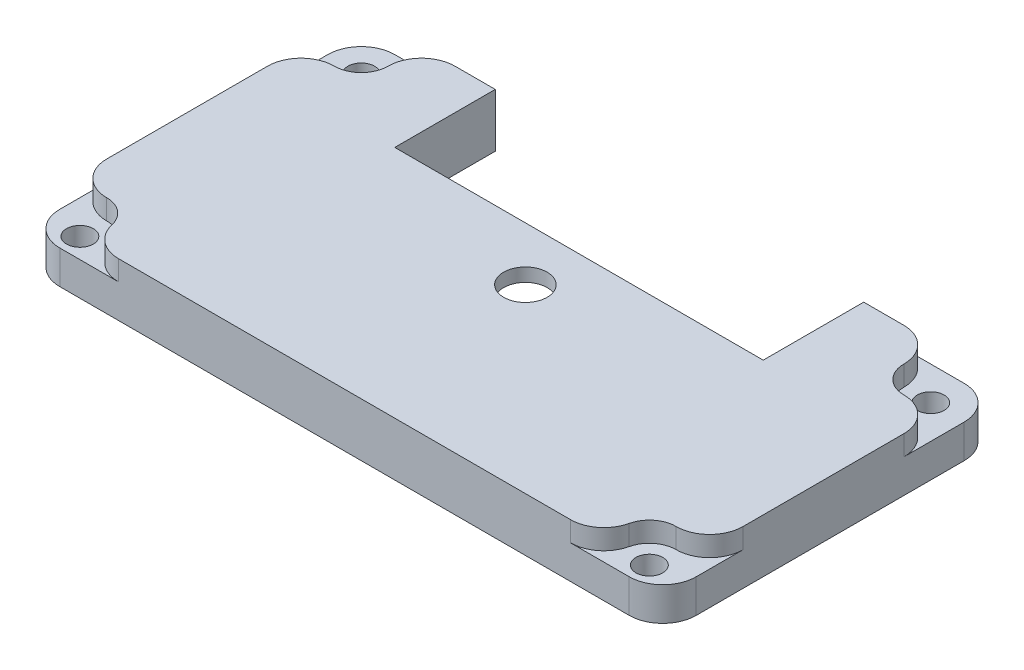
from build123d import *

# Parameters (mm, degrees)
SKETCH1_W           = 95
SKETCH1_H           = 50
BOSS_EXTRUDE1_DEPTH = 8
SKETCH2_W           = 55
SKETCH2_H           = 15
CUT_EXTRUDE1_DEPTH  = 55.270157545
SKETCH3_R           = 3.25
CUT_EXTRUDE2_DEPTH  = 55.270157545
SKETCH4_R           = 10.25
CUT_EXTRUDE3_DEPTH  = 6
FILLET1_R           = 5
SKETCH5_R           = 2
CUT_EXTRUDE4_DEPTH  = 55.270157545
CUT_EXTRUDE5_DEPTH  = 3
FILLET2_R           = 5


with BuildPart() as part:
    # Sketch1 → Boss-Extrude1 (new body)
    with BuildSketch(Plane(origin=(0, 0, 0), x_dir=(1, 0, 0), z_dir=(0, 1, 0))):
        Rectangle(SKETCH1_W, SKETCH1_H)
    extrude(amount=BOSS_EXTRUDE1_DEPTH)

    # Sketch2 → Cut-Extrude1 (cut, through all)
    with BuildSketch(Plane(origin=(0, 8, 0), x_dir=(1, 0, 0), z_dir=(0, 1, 0))):
        with Locations((0, 17.5)):
            Rectangle(SKETCH2_W, SKETCH2_H)
    extrude(amount=-CUT_EXTRUDE1_DEPTH, mode=Mode.SUBTRACT)

    # Sketch3 → Cut-Extrude2 (cut, through all)
    with BuildSketch(Plane(origin=(0, 8, 0), x_dir=(1, 0, 0), z_dir=(0, 1, 0))):
        with Locations(Location((0, 2, 0), (0, 0, 270))):
            Circle(SKETCH3_R)
    extrude(amount=-CUT_EXTRUDE2_DEPTH, mode=Mode.SUBTRACT)

    # Sketch4 → Cut-Extrude3 (cut)
    with BuildSketch(Plane.XZ):
        with Locations((0, -2)):
            Circle(SKETCH4_R)
    extrude(amount=-CUT_EXTRUDE3_DEPTH, mode=Mode.SUBTRACT)

    # Fillet1
    fillet1_edges = [part.edges().sort_by_distance(p)[0] for p in [
        (6.408002809, 3, -10),
        (-6.408002809, 3, -10),
    ]]
    fillet(fillet1_edges, radius=FILLET1_R)

    # Sketch5 → Cut-Extrude4 (cut, through all)
    with BuildSketch(Plane(origin=(0, 8, 0), x_dir=(1, 0, 0), z_dir=(0, 1, 0))):
        with Locations(Location((42.5, 20, 0), (0, 0, 270))):
            Circle(SKETCH5_R)
        with Locations(Location((42.5, -22, 0), (0, 0, 270))):
            Circle(SKETCH5_R)
        with Locations(Location((-42.5, -22, 0), (0, 0, 90))):
            Circle(SKETCH5_R)
        with Locations(Location((-42.5, 20, 0), (0, 0, 90))):
            Circle(SKETCH5_R)
    extrude(amount=-CUT_EXTRUDE4_DEPTH, mode=Mode.SUBTRACT)

    # Sketch6 → Cut-Extrude5 (cut)
    with BuildSketch(Plane(origin=(0, 8, 0), x_dir=(1, 0, 0), z_dir=(0, 1, 0))):
        with BuildLine():
            Line((-42.5, -18), (-47.5, -18))
            Line((-47.5, -18), (-47.5, -25))
            Line((-47.5, -25), (-45.145751311, -25))
            ThreePointArc((-45.145751311, -25), (-38.758342613, -23.414213562), (-42.5, -18))
        make_face()
        with BuildLine():
            Line((47.5, -25), (45.145751311, -25))
            ThreePointArc((45.145751311, -25), (38.758342613, -23.414213562), (42.5, -18))
            Line((42.5, -18), (47.5, -18))
            Line((47.5, -18), (47.5, -25))
        make_face()
        with BuildLine():
            Line((-42.5, 16), (-47.5, 16))
            Line((-47.5, 16), (-47.5, 25))
            Line((-47.5, 25), (-38.5, 25))
            Line((-38.5, 25), (-38.5, 20))
            ThreePointArc((-38.5, 20), (-39.671572875, 17.171572875), (-42.5, 16))
        make_face()
        with BuildLine():
            Line((42.5, 16), (47.5, 16))
            Line((47.5, 16), (47.5, 25))
            Line((47.5, 25), (38.5, 25))
            Line((38.5, 25), (38.5, 20))
            ThreePointArc((38.5, 20), (39.671572875, 17.171572875), (42.5, 16))
        make_face()
    extrude(amount=-CUT_EXTRUDE5_DEPTH, mode=Mode.SUBTRACT)

    # Fillet2
    fillet2_edges = [part.edges().sort_by_distance(p)[0] for p in [
        (-47.5, 6.5, 18),
        (-39.854248689, 6.5, 25),
        (47.5, 6.5, 18),
        (39.854248689, 6.5, 25),
        (-47.5, 2.5, 25),
        (47.5, 2.5, 25),
        (47.5, 2.5, -25),
        (47.5, 6.5, -16),
        (38.5, 6.5, -25),
        (-47.5, 2.5, -25),
        (-38.5, 6.5, -25),
        (-47.5, 6.5, -16),
    ]]
    fillet(fillet2_edges, radius=FILLET2_R - 0.0001)  # a hair under: the kernel refuses the full size


solid = part.part
